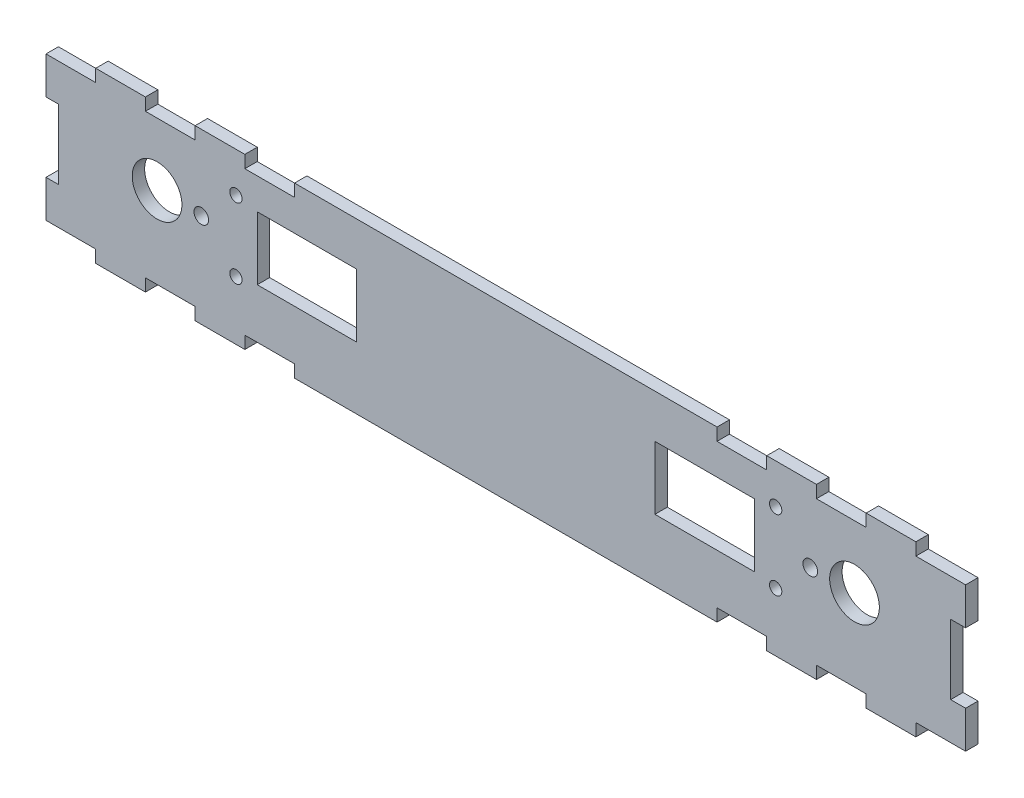
from build123d import *

# Parameters (mm, degrees)
SKETCH3_W           = 234.95
SKETCH3_H           = 30.48
SKETCH3_W_2         = 25.4
SKETCH3_H_2         = 16.15
SKETCH3_R           = 1.574999898
SKETCH3_R_2         = 1.875
SKETCH3_R_3         = 6.35
BOSS_EXTRUDE1_DEPTH = 3.175
BOSS_EXTRUDE2_DEPTH = 3.175
SKETCH5_W           = 3.175
SKETCH5_H           = 17.78
SKETCH5_W_2         = 3.81
CUT_EXTRUDE1_DEPTH  = 7.62


with BuildPart() as part:
    # Sketch3 → Boss-Extrude1 (new body)
    with BuildSketch(Plane.XY):
        with Locations((-63.5, 8.8475)):
            Rectangle(SKETCH3_W, SKETCH3_H)
        with Locations((-12.7, 11.25)):
            Rectangle(SKETCH3_W_2, SKETCH3_H_2, mode=Mode.SUBTRACT)
        with Locations((5.45, 2.250000072)):
            Circle(SKETCH3_R, mode=Mode.SUBTRACT)
        with Locations((14.3, 11.25)):
            Circle(SKETCH3_R_2, mode=Mode.SUBTRACT)
        with Locations((25.6, 11.25)):
            Circle(SKETCH3_R_3, mode=Mode.SUBTRACT)
        with Locations((5.45, 20.25)):
            Circle(SKETCH3_R, mode=Mode.SUBTRACT)
        with Locations((-114.3, 11.25)):
            Rectangle(SKETCH3_W_2, SKETCH3_H_2, mode=Mode.SUBTRACT)
        with Locations((-152.6, 11.25)):
            Circle(SKETCH3_R_3, mode=Mode.SUBTRACT)
        with Locations((-141.3, 11.25)):
            Circle(SKETCH3_R_2, mode=Mode.SUBTRACT)
        with Locations((-132.45, 20.25)):
            Circle(SKETCH3_R, mode=Mode.SUBTRACT)
        with Locations((-132.45, 2.250000072)):
            Circle(SKETCH3_R, mode=Mode.SUBTRACT)
    extrude(amount=BOSS_EXTRUDE1_DEPTH)

    # Sketch4 → Boss-Extrude2 (add)
    with BuildSketch(Plane.XY.offset(3.175)):
        Polygon((-155.575, 27.2625), (-155.575, 30.4375), (-168.275, 30.4375), (-168.275, 27.2625), (-180.975, 27.2625), (-180.975, 24.0875), (53.975, 24.0875), (53.975, 27.2625), (41.275, 27.2625), (41.275, 30.4375), (28.575, 30.4375), (28.575, 27.2625), (15.875, 27.2625), (15.875, 30.4375), (3.175, 30.4375), (3.175, 27.2625), (-9.525, 27.2625), (-9.525, 30.4375), (-117.475, 30.4375), (-117.475, 27.2625), (-130.175, 27.2625), (-130.175, 30.4375), (-142.875, 30.4375), (-142.875, 27.2625), align=None)
        Polygon((53.975, -6.3925), (-180.975, -6.3925), (-180.975, -9.5675), (-168.275, -9.5675), (-168.275, -12.7425), (-155.575, -12.7425), (-155.575, -9.5675), (-142.875, -9.5675), (-142.875, -12.7425), (-130.175, -12.7425), (-130.175, -9.5675), (-117.475, -9.5675), (-117.475, -12.7425), (-9.525, -12.7425), (-9.525, -9.5675), (3.175, -9.5675), (3.175, -12.7425), (15.875, -12.7425), (15.875, -9.5675), (28.575, -9.5675), (28.575, -12.7425), (41.275, -12.7425), (41.275, -9.5675), (53.975, -9.5675), align=None)
    extrude(amount=-BOSS_EXTRUDE2_DEPTH)

    # Sketch5 → Cut-Extrude1 (cut)
    with BuildSketch(Plane.XY.offset(3.175)):
        with Locations((-179.3875, 8.8475)):
            Rectangle(SKETCH5_W, SKETCH5_H)
        with Locations((52.07, 8.8475)):
            Rectangle(SKETCH5_W_2, SKETCH5_H)
    extrude(amount=-CUT_EXTRUDE1_DEPTH, mode=Mode.SUBTRACT)


solid = part.part
